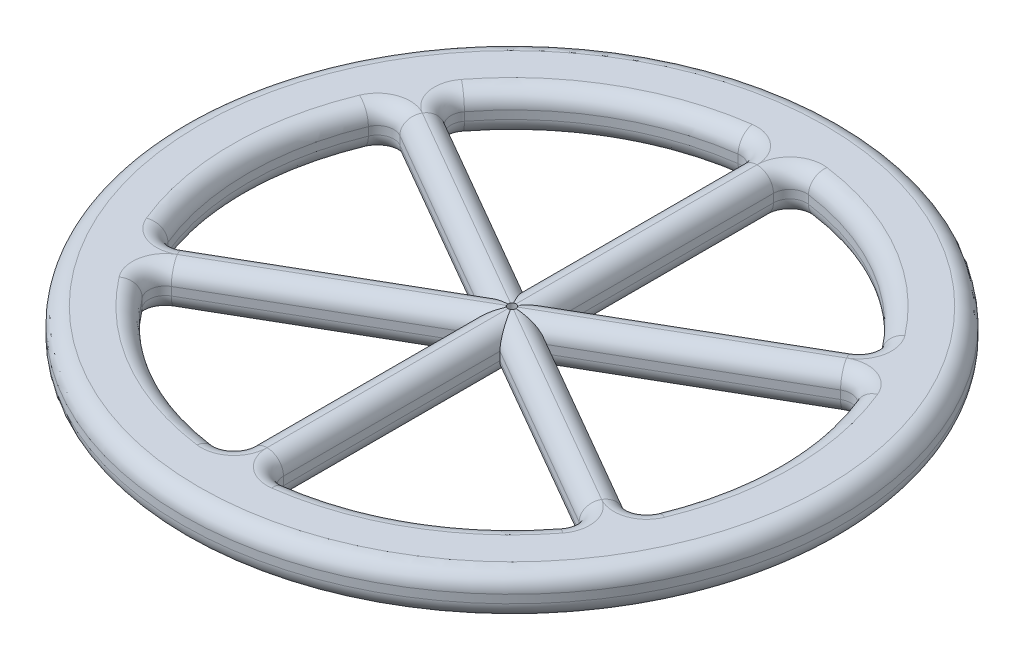
from build123d import *

# Parameters (mm, degrees)
SKETCH1_R           = 400
SKETCH1_R_2         = 320
SKETCH1_R_3         = 40
BOSS_EXTRUDE1_DEPTH = 50
FILLET2_R           = 20
FILLET3_R           = 20
SKETCH2_R           = 5
CUT_EXTRUDE1_DEPTH  = 568.89083473


with BuildPart() as part:
    # Sketch1 → Boss-Extrude1 (new body)
    # profile 1 of 8: a face of its own
    with BuildSketch(Plane(origin=(0, 0, 0), x_dir=(1, 0, 0), z_dir=(0, 1, 0))):
        with Locations(Location((0, 0, 0), (0, 0, 270))):
            Circle(SKETCH1_R)
        Circle(SKETCH1_R_2, mode=Mode.SUBTRACT)
    # profile 2 of 8: a face of its own
    with BuildSketch(Plane(origin=(0, 0, 0), x_dir=(1, 0, 0), z_dir=(0, 1, 0))):
        with BuildLine():
            Line((-20, 319.374388453), (-20, 34.641016151))
            ThreePointArc((-20, 34.641016151), (0, 40), (20, 34.641016151))
            Line((20, 34.641016151), (20, 319.374388453))
            ThreePointArc((20, 319.374388453), (0, 320), (-20, 319.374388453))
        make_face()
    # profile 3 of 8: a face of its own
    with BuildSketch(Plane(origin=(0, 0, 0), x_dir=(1, 0, 0), z_dir=(0, 1, 0))):
        with BuildLine():
            ThreePointArc((-40, 0), (-34.641016151, 20), (-20, 34.641016151))
            Line((-20, 34.641016151), (-266.586333719, 177.007702302))
            ThreePointArc((-266.586333719, 177.007702302), (-277.128129211, 160), (-286.586333719, 142.366686151))
            Line((-286.586333719, 142.366686151), (-40, 0))
        make_face()
    # profile 4 of 8: a face of its own
    with BuildSketch(Plane(origin=(0, 0, 0), x_dir=(1, 0, 0), z_dir=(0, 1, 0))):
        with BuildLine():
            ThreePointArc((-20, -34.641016151), (-34.641016151, -20), (-40, 0))
            Line((-40, 0), (-286.586333719, -142.366686151))
            ThreePointArc((-286.586333719, -142.366686151), (-277.128129211, -160), (-266.586333719, -177.007702302))
            Line((-266.586333719, -177.007702302), (-20, -34.641016151))
        make_face()
    # profile 5 of 8: a face of its own
    with BuildSketch(Plane(origin=(0, 0, 0), x_dir=(1, 0, 0), z_dir=(0, 1, 0))):
        with BuildLine():
            ThreePointArc((20, -34.641016151), (0, -40), (-20, -34.641016151))
            Line((-20, -34.641016151), (-20, -319.374388453))
            ThreePointArc((-20, -319.374388453), (0, -320), (20, -319.374388453))
            Line((20, -319.374388453), (20, -34.641016151))
        make_face()
    # profile 6 of 8: a face of its own
    with BuildSketch(Plane(origin=(0, 0, 0), x_dir=(1, 0, 0), z_dir=(0, 1, 0))):
        with BuildLine():
            Line((286.586333719, -142.366686151), (40, 0))
            ThreePointArc((40, 0), (34.641016151, -20), (20, -34.641016151))
            Line((20, -34.641016151), (266.586333719, -177.007702302))
            ThreePointArc((266.586333719, -177.007702302), (277.128129211, -160), (286.586333719, -142.366686151))
        make_face()
    # profile 7 of 8: a face of its own
    with BuildSketch(Plane(origin=(0, 0, 0), x_dir=(1, 0, 0), z_dir=(0, 1, 0))):
        with BuildLine():
            Line((266.586333719, 177.007702302), (20, 34.641016151))
            ThreePointArc((20, 34.641016151), (34.641016151, 20), (40, 0))
            Line((40, 0), (286.586333719, 142.366686151))
            ThreePointArc((286.586333719, 142.366686151), (277.128129211, 160), (266.586333719, 177.007702302))
        make_face()
    # profile 8 of 8: a face of its own
    with BuildSketch(Plane(origin=(0, 0, 0), x_dir=(1, 0, 0), z_dir=(0, 1, 0))):
        Circle(SKETCH1_R_3)
    extrude(amount=BOSS_EXTRUDE1_DEPTH)

    # Fillet2
    fillet2_edges = [part.edges().sort_by_distance(p)[0] for p in [
        (-143.293166859, 50, 105.824359227),
        (143.293166859, 50, 105.824359227),
        (-20, 50, 177.007702302),
        (-160, 50, 277.128129211),
        (143.293166859, 0, 105.824359227),
        (20, 0, 177.007702302),
        (160, 0, 277.128129211),
        (320, 0, 0),
        (-163.293166859, 50, -71.183343076),
        (163.293166859, 0, -71.183343076),
        (163.293166859, 0, 71.183343076),
        (160, 0, -277.128129211),
        (20, 0, -177.007702302),
        (143.293166859, 0, -105.824359227),
        (-160, 0, -277.128129211),
        (-163.293166859, 50, 71.183343076),
        (-143.293166859, 0, -105.824359227),
        (-20, 0, -177.007702302),
        (-320, 0, 0),
        (-163.293166859, 0, 71.183343076),
        (-163.293166859, 0, -71.183343076),
        (-160, 0, 277.128129211),
        (-320, 50, 0),
        (-20, 0, 177.007702302),
        (-143.293166859, 0, 105.824359227),
        (266.586333719, 25, 177.007702302),
        (20, 25, 319.374388453),
        (286.586333719, 25, 142.366686151),
        (286.586333719, 25, -142.366686151),
        (266.586333719, 25, -177.007702302),
        (20, 25, -319.374388453),
        (-20, 25, -319.374388453),
        (-266.586333719, 25, -177.007702302),
        (-286.586333719, 25, -142.366686151),
        (-286.586333719, 25, 142.366686151),
        (-266.586333719, 25, 177.007702302),
        (-20, 50, -177.007702302),
        (-20, 25, 319.374388453),
        (-143.293166859, 50, -105.824359227),
        (-160, 50, -277.128129211),
        (143.293166859, 50, -105.824359227),
        (20, 50, -177.007702302),
        (160, 50, -277.128129211),
        (163.293166859, 50, 71.183343076),
        (163.293166859, 50, -71.183343076),
        (320, 50, 0),
        (160, 50, 277.128129211),
        (20, 50, 177.007702302),
    ]]
    fillet(fillet2_edges, radius=FILLET2_R - 0.0001)  # a hair under: the kernel refuses the full size

    # Fillet3
    fillet3_edges = [part.edges().sort_by_distance(p)[0] for p in [
        (0, 50, -400),
        (0, 0, -400),
    ]]
    fillet(fillet3_edges, radius=FILLET3_R)

    # Sketch2 → Cut-Extrude1 (cut, through all)
    with BuildSketch(Plane.XZ):
        with Locations(Location((0, 0, 0), (0, 0, 270))):
            Circle(SKETCH2_R)
    extrude(amount=-CUT_EXTRUDE1_DEPTH, mode=Mode.SUBTRACT)


solid = part.part
